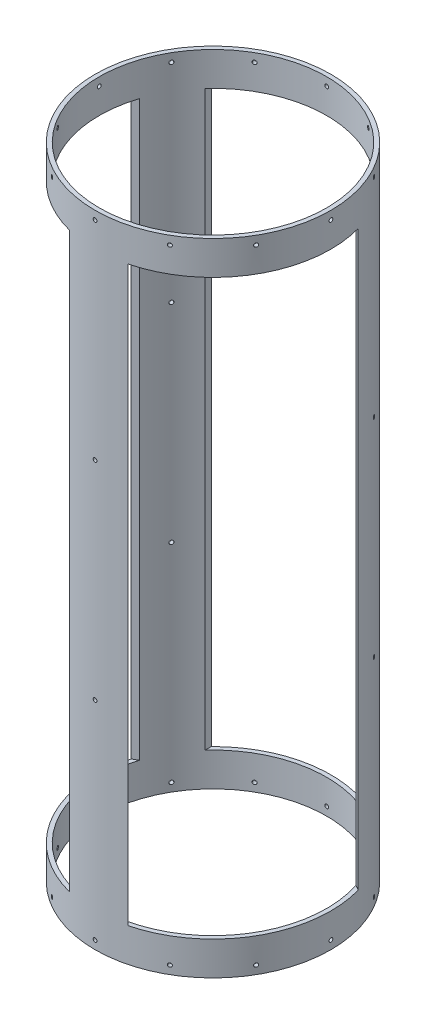
from build123d import *

# Parameters (mm, degrees)
SKETCH1_R                = 88.9
SKETCH1_R_2              = 85.725
BOSS_EXTRUDE1_DEPTH      = 241.427
CUT_EXTRUDE1_REACH       = 274.201
CUT_EXTRUDE1_END_RADIUS  = 88.9
SKETCH2_W                = 127
SKETCH2_H                = 432.054
CIRPATTERN1_COUNT        = 3
SKETCH4_R                = 1.4351
CUT_EXTRUDE3_DEPTH       = 15.24
CIRPATTERN3_COUNT        = 12
MIRROR1_COPY_1_SKETCH_R  = 1.4351
MIRROR1_COPY_1_DEPTH     = 15.24
MIRROR1_COPY_2_SKETCH_R  = 1.4351
MIRROR1_COPY_2_DEPTH     = 15.24
MIRROR1_COPY_3_SKETCH_R  = 1.4351
MIRROR1_COPY_3_DEPTH     = 15.24
MIRROR1_COPY_4_SKETCH_R  = 1.4351
MIRROR1_COPY_4_DEPTH     = 15.24
MIRROR1_COPY_5_SKETCH_R  = 1.4351
MIRROR1_COPY_5_DEPTH     = 15.24
MIRROR1_COPY_6_SKETCH_R  = 1.4351
MIRROR1_COPY_6_DEPTH     = 15.24
MIRROR1_COPY_7_SKETCH_R  = 1.4351
MIRROR1_COPY_7_DEPTH     = 15.24
MIRROR1_COPY_8_SKETCH_R  = 1.4351
MIRROR1_COPY_8_DEPTH     = 15.24
MIRROR1_COPY_9_SKETCH_R  = 1.4351
MIRROR1_COPY_9_DEPTH     = 15.24
MIRROR1_COPY_10_SKETCH_R = 1.4351
MIRROR1_COPY_10_DEPTH    = 15.24
MIRROR1_COPY_11_SKETCH_R = 1.4351
MIRROR1_COPY_11_DEPTH    = 15.24
SKETCH5_R                = 1.4351
CUT_EXTRUDE4_DEPTH       = 22.86
CIRPATTERN4_COUNT        = 3


with BuildPart() as part:
    # Sketch1 → Boss-Extrude1 (new, symmetric)
    with BuildSketch(Plane(origin=(0, 0, 0), x_dir=(1, 0, 0), z_dir=(0, 1, 0))):
        Circle(SKETCH1_R)
        Circle(SKETCH1_R_2, mode=Mode.SUBTRACT)
    extrude(amount=BOSS_EXTRUDE1_DEPTH, both=True)

    # Cut-Extrude1: up to this cylinder (the profile starts inside it)
    cut_extrude1_end = Plane(origin=(0, 0, 0), z_dir=(0, -1, 0)) * Cylinder(CUT_EXTRUDE1_END_RADIUS, 727.202, mode=Mode.PRIVATE)
    # Sketch2 → Cut-Extrude1 (cut, up to the surface)
    with BuildSketch(Plane.XY, mode=Mode.PRIVATE) as cut_extrude1_sk1:
        Rectangle(SKETCH2_W, SKETCH2_H)
    cut_extrude1_tool1 = extrude(cut_extrude1_sk1.sketch, amount=-CUT_EXTRUDE1_REACH, mode=Mode.PRIVATE) & cut_extrude1_end
    cut_extrude1 = cut_extrude1_tool1.solids().sort_by_distance((0, 0, 0))[0]
    add(cut_extrude1, mode=Mode.SUBTRACT)

    # CirPattern1: Cut-Extrude1 ×3 about axis
    cirpattern1_axis = Axis((0, 241.427, 0), (0, -1, 0))
    for i in range(1, CIRPATTERN1_COUNT):
        add(cut_extrude1.rotate(cirpattern1_axis, i * 360 / CIRPATTERN1_COUNT), mode=Mode.SUBTRACT)

    # Sketch4 → Cut-Extrude3 (cut)
    with BuildSketch(Plane(origin=(88.9, 0, 0), x_dir=(0, 0, -1), z_dir=(1, 0, 0))):
        with Locations((0, 235.077)):
            Circle(SKETCH4_R)
    cut_extrude3 = extrude(amount=-CUT_EXTRUDE3_DEPTH, mode=Mode.SUBTRACT)

    # CirPattern3: Cut-Extrude3 ×12 about axis
    cirpattern3_axis = Axis((0, 241.427, 0), (0, -1, 0))
    for i in range(1, CIRPATTERN3_COUNT):
        add(cut_extrude3.rotate(cirpattern3_axis, i * 360 / CIRPATTERN3_COUNT), mode=Mode.SUBTRACT)

    # Mirror1: Cut-Extrude3 across plane
    add(cut_extrude3.mirror(Plane.ZX), mode=Mode.SUBTRACT)

    # Mirror1 copy 1 sketch → Mirror1 copy 1 (cut)
    with BuildSketch(Plane(origin=(76.989658396, 0, 44.45), x_dir=(0.49999999999999994, 0, -0.8660254037844387), z_dir=(0.8660254037844387, 0, 0.49999999999999994))):
        with Locations((0, -235.077)):
            Circle(MIRROR1_COPY_1_SKETCH_R)
    extrude(amount=-MIRROR1_COPY_1_DEPTH, mode=Mode.SUBTRACT)

    # Mirror1 copy 2 sketch → Mirror1 copy 2 (cut)
    with BuildSketch(Plane(origin=(44.45, 0, 76.989658396), x_dir=(0.8660254037844386, 0, -0.5000000000000001), z_dir=(0.5000000000000001, 0, 0.8660254037844386))):
        with Locations((0, -235.077)):
            Circle(MIRROR1_COPY_2_SKETCH_R)
    extrude(amount=-MIRROR1_COPY_2_DEPTH, mode=Mode.SUBTRACT)

    # Mirror1 copy 3 sketch → Mirror1 copy 3 (cut)
    with BuildSketch(Plane.XY.offset(88.9)):
        with Locations((0, -235.077)):
            Circle(MIRROR1_COPY_3_SKETCH_R)
    extrude(amount=-MIRROR1_COPY_3_DEPTH, mode=Mode.SUBTRACT)

    # Mirror1 copy 4 sketch → Mirror1 copy 4 (cut)
    with BuildSketch(Plane(origin=(-44.45, 0, 76.989658396), x_dir=(0.8660254037844387, 0, 0.4999999999999998), z_dir=(-0.4999999999999998, 0, 0.8660254037844387))):
        with Locations((0, -235.077)):
            Circle(MIRROR1_COPY_4_SKETCH_R)
    extrude(amount=-MIRROR1_COPY_4_DEPTH, mode=Mode.SUBTRACT)

    # Mirror1 copy 5 sketch → Mirror1 copy 5 (cut)
    with BuildSketch(Plane(origin=(-76.989658396, 0, 44.45), x_dir=(0.49999999999999994, 0, 0.8660254037844387), z_dir=(-0.8660254037844387, 0, 0.49999999999999994))):
        with Locations((0, -235.077)):
            Circle(MIRROR1_COPY_5_SKETCH_R)
    extrude(amount=-MIRROR1_COPY_5_DEPTH, mode=Mode.SUBTRACT)

    # Mirror1 copy 6 sketch → Mirror1 copy 6 (cut)
    with BuildSketch(Plane.ZY.offset(88.9)):
        with Locations((0, -235.077)):
            Circle(MIRROR1_COPY_6_SKETCH_R)
    extrude(amount=-MIRROR1_COPY_6_DEPTH, mode=Mode.SUBTRACT)

    # Mirror1 copy 7 sketch → Mirror1 copy 7 (cut)
    with BuildSketch(Plane(origin=(-76.989658396, 0, -44.45), x_dir=(-0.5000000000000001, 0, 0.8660254037844386), z_dir=(-0.8660254037844386, 0, -0.5000000000000001))):
        with Locations((0, -235.077)):
            Circle(MIRROR1_COPY_7_SKETCH_R)
    extrude(amount=-MIRROR1_COPY_7_DEPTH, mode=Mode.SUBTRACT)

    # Mirror1 copy 8 sketch → Mirror1 copy 8 (cut)
    with BuildSketch(Plane(origin=(-44.45, 0, -76.989658396), x_dir=(-0.8660254037844384, 0, 0.5000000000000004), z_dir=(-0.5000000000000004, 0, -0.8660254037844384))):
        with Locations((0, -235.077)):
            Circle(MIRROR1_COPY_8_SKETCH_R)
    extrude(amount=-MIRROR1_COPY_8_DEPTH, mode=Mode.SUBTRACT)

    # Mirror1 copy 9 sketch → Mirror1 copy 9 (cut)
    with BuildSketch(Plane(origin=(0, 0, -88.9), x_dir=(-1, 0, 0), z_dir=(0, 0, -1))):
        with Locations((0, -235.077)):
            Circle(MIRROR1_COPY_9_SKETCH_R)
    extrude(amount=-MIRROR1_COPY_9_DEPTH, mode=Mode.SUBTRACT)

    # Mirror1 copy 10 sketch → Mirror1 copy 10 (cut)
    with BuildSketch(Plane(origin=(44.45, 0, -76.989658396), x_dir=(-0.8660254037844386, 0, -0.5000000000000001), z_dir=(0.5000000000000001, 0, -0.8660254037844386))):
        with Locations((0, -235.077)):
            Circle(MIRROR1_COPY_10_SKETCH_R)
    extrude(amount=-MIRROR1_COPY_10_DEPTH, mode=Mode.SUBTRACT)

    # Mirror1 copy 11 sketch → Mirror1 copy 11 (cut)
    with BuildSketch(Plane(origin=(76.989658396, 0, -44.45), x_dir=(-0.5000000000000004, 0, -0.8660254037844384), z_dir=(0.8660254037844384, 0, -0.5000000000000004))):
        with Locations((0, -235.077)):
            Circle(MIRROR1_COPY_11_SKETCH_R)
    extrude(amount=-MIRROR1_COPY_11_DEPTH, mode=Mode.SUBTRACT)

    # Sketch5 → Cut-Extrude4 (cut)
    with BuildSketch(Plane.XY.offset(88.9)):
        with Locations((0, 78.359)):
            Circle(SKETCH5_R)
        with Locations((0, -78.359)):
            Circle(SKETCH5_R)
    cut_extrude4 = extrude(amount=-CUT_EXTRUDE4_DEPTH, mode=Mode.SUBTRACT)

    # CirPattern4: Cut-Extrude4 ×3 about axis
    cirpattern4_axis = Axis((0, 241.427, 0), (0, -1, 0))
    for i in range(1, CIRPATTERN4_COUNT):
        add(cut_extrude4.rotate(cirpattern4_axis, i * 360 / CIRPATTERN4_COUNT), mode=Mode.SUBTRACT)


solid = part.part
